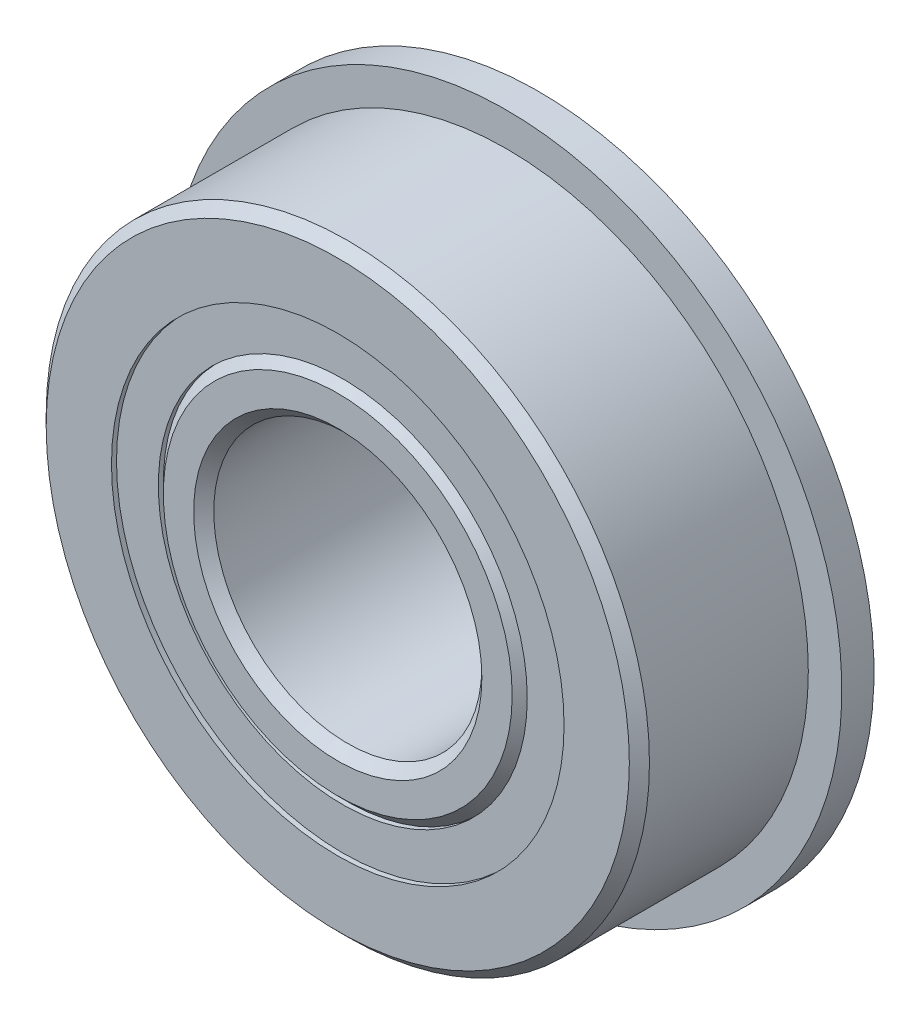
from build123d import *

# Parameters (mm, degrees)
SKETCH6_W         = 1.524
SKETCH6_H         = 5.1562
CIRPATTERN1_COUNT = 12
SKETCH5_W         = 2.743836812
SKETCH5_H         = 1.9812


with BuildPart() as part:
    # Sketch1 → Revolve1 (revolve)
    with BuildSketch(Plane(origin=(0, 0, 0), x_dir=(0, 0, -1), z_dir=(1, 0, 0))):
        with BuildLine():
            Line((4.28625, 14.2875), (-4.28625, 14.2875))
            Line((-4.28625, 14.2875), (-4.7625, 13.81125))
            Line((-4.7625, 13.81125), (-4.7625, 10.7188))
            Line((-4.7625, 10.7188), (-2.347405282, 10.7188))
            ThreePointArc((-2.347405282, 10.7188), (0, 12.7), (2.347405282, 10.7188))
            Line((2.347405282, 10.7188), (4.7625, 10.7188))
            Line((4.7625, 10.7188), (4.7625, 13.81125))
            Line((4.7625, 13.81125), (4.28625, 14.2875))
        make_face()
    revolve(axis=Axis((0, 0, 4.7625), (0, 0, -1)))

    # Sketch6 → Revolve6 (revolve)
    with BuildSketch(Plane(origin=(0, 0, 0), x_dir=(0, 0, -1), z_dir=(1, 0, 0))):
        with Locations((4.0005, 13.2969)):
            Rectangle(SKETCH6_W, SKETCH6_H)
    revolve(axis=Axis((0, 0, -4.7625), (0, 0, 1)))


with BuildPart() as body_2:
    # Sketch3 → Revolve3 (revolve)
    with BuildSketch(Plane(origin=(0, 0, 0), x_dir=(0, 0, -1), z_dir=(1, 0, 0))):
        with BuildLine():
            Line((-4.7625, 6.82625), (-4.7625, 8.26135))
            Line((-4.7625, 8.26135), (-4.28625, 8.7376))
            Line((-4.28625, 8.7376), (-1.780538188, 8.7376))
            ThreePointArc((-1.780538188, 8.7376), (0, 7.9375), (1.780538188, 8.7376))
            Line((1.780538188, 8.7376), (5.88645, 8.7376))
            Line((5.88645, 8.7376), (6.3627, 8.26135))
            Line((6.3627, 8.26135), (6.3627, 6.82625))
            Line((6.3627, 6.82625), (5.88645, 6.35))
            Line((5.88645, 6.35), (-4.28625, 6.35))
            Line((-4.28625, 6.35), (-4.7625, 6.82625))
        make_face()
    revolve(axis=Axis((0, 0, 4.7625), (0, 0, -1)))


with BuildPart() as body_3:
    # Sketch4 → Revolve4 (revolve)
    with BuildSketch(Plane(origin=(0, 0, 0), x_dir=(0, 0, -1), z_dir=(1, 0, 0))):
        with BuildLine():
            Line((-2.38125, 10.31875), (2.38125, 10.31875))
            ThreePointArc((2.38125, 10.31875), (0, 12.7), (-2.38125, 10.31875))
        make_face()
    revolve(axis=Axis((0, 10.31875, 2.38125), (0, 0, -1)))


with BuildPart() as cirpattern1_1:
    # CirPattern1: pattern copy
    add(body_3.part.rotate(Axis((0, 0, -4.7625), (0, 0, 1)), 1 * 360 / CIRPATTERN1_COUNT))


with BuildPart() as cirpattern1_2:
    # CirPattern1: pattern copy
    add(body_3.part.rotate(Axis((0, 0, -4.7625), (0, 0, 1)), 2 * 360 / CIRPATTERN1_COUNT))


with BuildPart() as cirpattern1_3:
    # CirPattern1: pattern copy
    add(body_3.part.rotate(Axis((0, 0, -4.7625), (0, 0, 1)), 3 * 360 / CIRPATTERN1_COUNT))


with BuildPart() as cirpattern1_4:
    # CirPattern1: pattern copy
    add(body_3.part.rotate(Axis((0, 0, -4.7625), (0, 0, 1)), 4 * 360 / CIRPATTERN1_COUNT))


with BuildPart() as cirpattern1_5:
    # CirPattern1: pattern copy
    add(body_3.part.rotate(Axis((0, 0, -4.7625), (0, 0, 1)), 5 * 360 / CIRPATTERN1_COUNT))


with BuildPart() as cirpattern1_6:
    # CirPattern1: pattern copy
    add(body_3.part.rotate(Axis((0, 0, -4.7625), (0, 0, 1)), 6 * 360 / CIRPATTERN1_COUNT))


with BuildPart() as cirpattern1_7:
    # CirPattern1: pattern copy
    add(body_3.part.rotate(Axis((0, 0, -4.7625), (0, 0, 1)), 7 * 360 / CIRPATTERN1_COUNT))


with BuildPart() as cirpattern1_8:
    # CirPattern1: pattern copy
    add(body_3.part.rotate(Axis((0, 0, -4.7625), (0, 0, 1)), 8 * 360 / CIRPATTERN1_COUNT))


with BuildPart() as cirpattern1_9:
    # CirPattern1: pattern copy
    add(body_3.part.rotate(Axis((0, 0, -4.7625), (0, 0, 1)), 9 * 360 / CIRPATTERN1_COUNT))


with BuildPart() as cirpattern1_10:
    # CirPattern1: pattern copy
    add(body_3.part.rotate(Axis((0, 0, -4.7625), (0, 0, 1)), 10 * 360 / CIRPATTERN1_COUNT))


with BuildPart() as cirpattern1_11:
    # CirPattern1: pattern copy
    add(body_3.part.rotate(Axis((0, 0, -4.7625), (0, 0, 1)), 11 * 360 / CIRPATTERN1_COUNT))


with BuildPart() as body_15:
    # Sketch5 → Revolve5 (revolve)
    with BuildSketch(Plane(origin=(0, 0, 0), x_dir=(0, 0, -1), z_dir=(1, 0, 0))):
        with Locations((-3.152456594, 9.7282)):
            Rectangle(SKETCH5_W, SKETCH5_H)
        with Locations((3.152456594, 9.7282)):
            Rectangle(SKETCH5_W, SKETCH5_H)
    revolve(axis=Axis((0, 0, 4.7625), (0, 0, -1)))


solid = Compound([part.part, body_2.part, body_3.part, cirpattern1_1.part, cirpattern1_2.part, cirpattern1_3.part, cirpattern1_4.part, cirpattern1_5.part, cirpattern1_6.part, cirpattern1_7.part, cirpattern1_8.part, cirpattern1_9.part, cirpattern1_10.part, cirpattern1_11.part, body_15.part])
